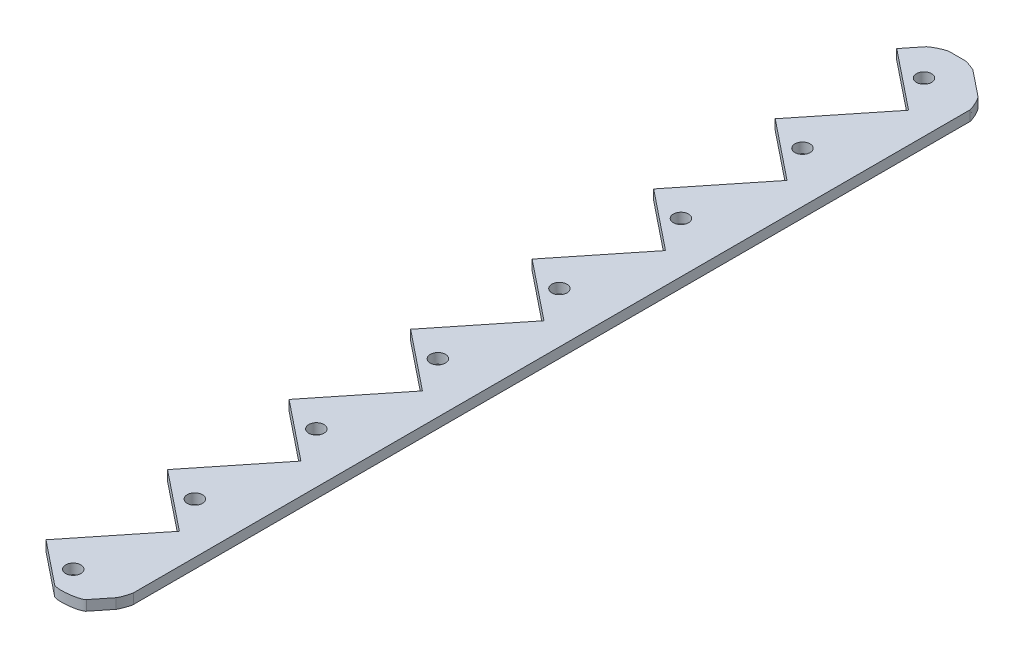
from build123d import *

# Parameters (mm, degrees)
SKETCH2_R           = 1.190625
BOSS_EXTRUDE1_DEPTH = 1.5875
FILLET1_SIZE        = 3.175


with BuildPart() as part:
    # Sketch2 → Boss-Extrude1 (new body)
    with BuildSketch(Plane(origin=(0, 0, 0), x_dir=(1, 0, 0), z_dir=(0, 1, 0))):
        Polygon((29.393690453, -107.736776908), (34.156190453, -101.788416314), (34.156190453, 31.968309197), (28.155939525, 36.772354713), (23.075939525, 36.772354713), (20.099377025, 33.054629342), (29.393690453, 25.613223092), (20.099377025, 14.004629342), (24.746533739, 10.283926217), (29.393690453, 6.563223092), (20.099377025, -5.045370658), (29.393690453, -12.486776908), (20.099377025, -24.095370658), (29.393690453, -31.536776908), (20.099377025, -43.145370658), (29.393690453, -50.586776908), (20.099377025, -62.195370658), (29.393690453, -69.636776908), (20.099377025, -81.245370658), (29.393690453, -88.686776908), (20.099377025, -100.295370658), align=None)
        with Locations(Location((26.234814989, -102.157211097, 0), (0, 0, 270))):
            Circle(SKETCH2_R, mode=Mode.SUBTRACT)
        with Locations(Location((26.234814989, -83.107211097, 0), (0, 0, 270))):
            Circle(SKETCH2_R, mode=Mode.SUBTRACT)
        with Locations(Location((26.234814989, -64.057211097, 0), (0, 0, 270))):
            Circle(SKETCH2_R, mode=Mode.SUBTRACT)
        with Locations(Location((26.234814989, -45.007211097, 0), (0, 0, 270))):
            Circle(SKETCH2_R, mode=Mode.SUBTRACT)
        with Locations(Location((26.234814989, -25.957211097, 0), (0, 0, 270))):
            Circle(SKETCH2_R, mode=Mode.SUBTRACT)
        with Locations(Location((26.234814989, -6.907211097, 0), (0, 0, 270))):
            Circle(SKETCH2_R, mode=Mode.SUBTRACT)
        with BuildLine():
            ThreePointArc((27.425439989, 12.142788903), (26.750370737, 11.069574031), (25.490674364, 11.21335756))
            ThreePointArc((25.490674364, 11.21335756), (25.719259241, 13.216003775), (27.425439989, 12.142788903))
        make_face(mode=Mode.SUBTRACT)
        with Locations(Location((26.234814989, 31.192788903, 0), (0, 0, 270))):
            Circle(SKETCH2_R, mode=Mode.SUBTRACT)
    extrude(amount=BOSS_EXTRUDE1_DEPTH)

    # Fillet1
    # a fillet whose section is not a circle: 3.175 mm, written as the material it takes off along each edge
    with BuildSketch(Plane(origin=(29.393690453, -7.9375, 107.736776908), x_dir=(0.6249999999921612, 0, -0.7806247498060759), z_dir=(0, 1, 0))) as fillet1_piece_1:
        with BuildLine():
            Bezier((FILLET1_SIZE, 0), (0, 0), (0, FILLET1_SIZE), weights=[1, 0.224506403, 1])
            Line((0, FILLET1_SIZE), (0, 0))
            Line((0, 0), (FILLET1_SIZE, 0))
        make_face()
    extrude(amount=17.4625, mode=Mode.SUBTRACT)
    with BuildSketch(Plane(origin=(34.156190453, -2.786065678, 101.788416314), x_dir=(-0.6250000000189532, 0, 0.7806247497846253), z_dir=(0, 1, 0))) as fillet1_piece_2:
        with BuildLine():
            Bezier((1.114426271, 0), (0, 0), (-0.869948729, -0.696516419), weights=[1, 0.299581461, 1])
            Line((-0.869948729, -0.696516419), (0, 0))
            Line((0, 0), (1.114426271, 0))
        make_face()
    extrude(amount=7.159631356, mode=Mode.SUBTRACT)
    with BuildSketch(Plane(origin=(34.156190453, -3.813051663, -31.968309197), x_dir=(-0.7806247498123451, 0, -0.624999999984331), z_dir=(0, 1, 0)), Plane(origin=(23.075939525, -3.813051662, -36.772354713), x_dir=(-0.6250000000000002, 0, 0.7806247497997996), z_dir=(0, 1, 0))) as fillet1_piece_3:
        with BuildLine():
            Bezier((1.525220665, 0), (0, 0), (-0.953262916, 1.190625), weights=[1, 0.286190632, 1])
            Line((-0.953262916, 1.190625), (0, 0))
            Line((0, 0), (1.525220665, 0))
        make_face()
    extrude(amount=9.213603325, mode=Mode.SUBTRACT)
    with BuildSketch(Plane(origin=(28.155939525, -2.786065678, -36.772354713), x_dir=(-1, 0, 0), z_dir=(0, 1, 0))) as fillet1_piece_4:
        with BuildLine():
            Bezier((1.114426271, 0), (0, 0), (-0.869948729, 0.696516419), weights=[1, 0.299581461, 1])
            Line((-0.869948729, 0.696516419), (0, 0))
            Line((0, 0), (1.114426271, 0))
        make_face()
    extrude(amount=7.159631355, mode=Mode.SUBTRACT)


solid = part.part
